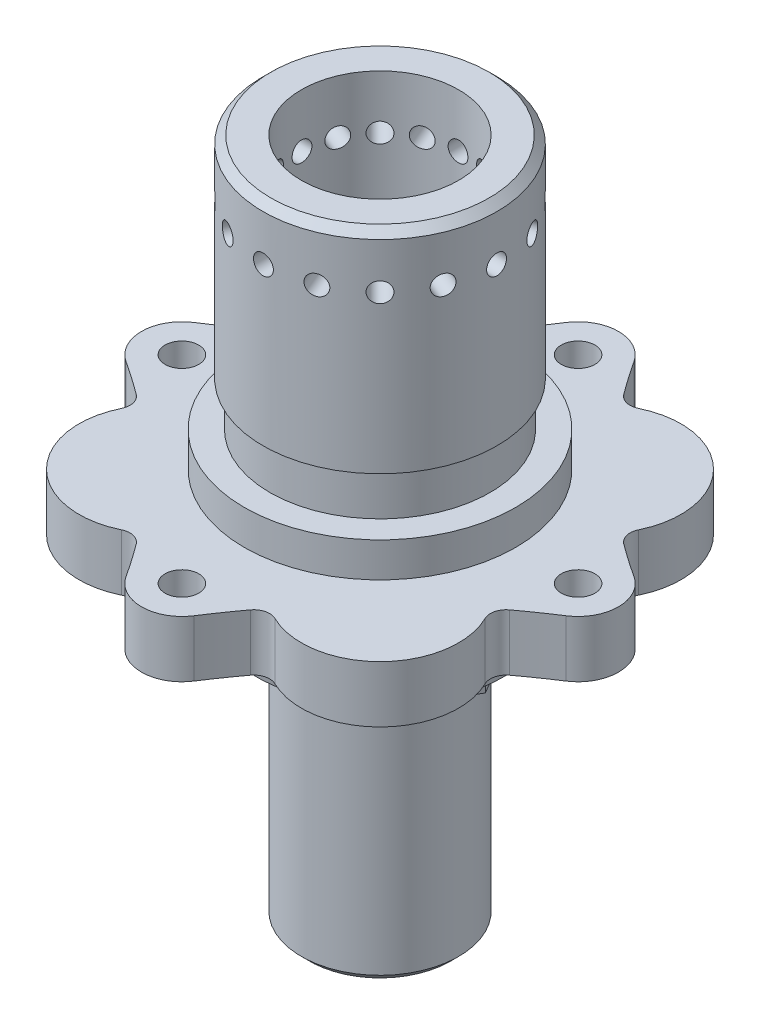
from build123d import *

# Parameters (mm, degrees)
SKETCH5_W                     = 15.875
SKETCH5_H                     = 79.375
DRIVE_PIN_HOLES_D             = 6.8
DRIVE_PIN_HOLES_PATTERN_COUNT = 4
FLANGE_SUPPORT_CUT_REACH      = 103.939
SKETCH8_R                     = 52.5
SKETCH10_R                    = 25.0825
BRAKE_HAT_HEX_DEPTH           = 4.7625
M10_CLEARANCE_HOLE1_D         = 11
SKETCH14_R                    = 2
PIN_HOLES_DEPTH               = 98.561648779
PIN_HOLE_PATTERN_COUNT        = 16
FILLET1_R                     = 3.175


with BuildPart() as part:
    # Sketch1 → Bearing Shaft/Flange Support (revolve)
    with BuildSketch(Plane(origin=(0, 0, 0), x_dir=(0, 0, -1), z_dir=(1, 0, 0))):
        Polygon((0, 0), (-27.254672075, 0), (-25.0825, -12.319), (-25.0825, -17.0815), (-15.875, -17.0815), (-15.875, -65.8749), (-14.2875, -67.4624), (0, -67.4624), align=None)
    revolve(axis=Axis((0, 0, 0), (0, 1, 0)))

    # Sketch2 → Drive Pin Support (revolve)
    with BuildSketch(Plane(origin=(0, 0, 0), x_dir=(0, 0, -1), z_dir=(1, 0, 0))):
        Polygon((0, 0), (-52.5, 0), (-52.5, 11.43), (-27.4096, 11.43), (-27.4096, 18.43), (-22.225, 18.43), (-22.225, 27.305), (-23.61946, 27.305), (-23.61946, 68.2625), (-22.03196, 69.85), (0, 69.85), align=None)
    revolve(axis=Axis((0, 0, 0), (0, 1, 0)))

    # Sketch5 → Center Mass Removal (revolve, cut)
    with BuildSketch(Plane(origin=(0, 0, 0), x_dir=(0, 0, -1), z_dir=(1, 0, 0))):
        with Locations((7.9375, 30.1625)):
            Rectangle(SKETCH5_W, SKETCH5_H)
    revolve(axis=Axis((0, 0, 0), (0, -1, 0)), mode=Mode.SUBTRACT)

    # Drive Pin Holes (through all)
    with Locations(Plane(origin=(0, 0, 0), x_dir=(-1, 0, 0), z_dir=(0, -1, 0))):
        with Locations((0, -40)):
            drive_pin_holes = Hole(DRIVE_PIN_HOLES_D / 2)

    # Drive Pin Holes Pattern: Drive Pin Holes ×4 about axis
    drive_pin_holes_pattern_axis = Axis((0, 0, 0), (0, -1, 0))
    for i in range(1, DRIVE_PIN_HOLES_PATTERN_COUNT):
        add(drive_pin_holes.rotate(drive_pin_holes_pattern_axis, i * 360 / DRIVE_PIN_HOLES_PATTERN_COUNT), mode=Mode.SUBTRACT)

    # Sketch8 → Flange Support Cut (cut, up to next)
    with BuildSketch(Plane.XZ, mode=Mode.PRIVATE) as flange_support_cut_sk1:
        Circle(SKETCH8_R)
        with BuildLine():
            ThreePointArc((-6.851776468, 44.436165629), (0, 48.1625), (6.851776468, 44.436165629))
            ThreePointArc((6.851776468, 44.436165629), (9.964767607, 39.850591878), (13.274865482, 35.405206349))
            ThreePointArc((13.274865482, 35.405206349), (33.675960454, 33.675960454), (35.405206349, 13.274865482))
            ThreePointArc((35.405206349, 13.274865482), (39.850591878, 9.964767607), (44.436165629, 6.851776468))
            ThreePointArc((44.436165629, 6.851776468), (48.1625, 0), (44.436165629, -6.851776468))
            ThreePointArc((44.436165629, -6.851776468), (39.850591878, -9.964767607), (35.405206349, -13.274865482))
            ThreePointArc((35.405206349, -13.274865482), (33.675960454, -33.675960454), (13.274865482, -35.405206349))
            ThreePointArc((13.274865482, -35.405206349), (9.964767607, -39.850591878), (6.851776468, -44.436165629))
            ThreePointArc((6.851776468, -44.436165629), (0, -48.1625), (-6.851776468, -44.436165629))
            ThreePointArc((-6.851776468, -44.436165629), (-9.964767607, -39.850591878), (-13.274865482, -35.405206349))
            ThreePointArc((-13.274865482, -35.405206349), (-33.675960454, -33.675960454), (-35.405206349, -13.274865482))
            ThreePointArc((-35.405206349, -13.274865482), (-39.850591878, -9.964767607), (-44.436165629, -6.851776468))
            ThreePointArc((-44.436165629, -6.851776468), (-48.1625, 0), (-44.436165629, 6.851776468))
            ThreePointArc((-44.436165629, 6.851776468), (-39.850591878, 9.964767607), (-35.405206349, 13.274865482))
            ThreePointArc((-35.405206349, 13.274865482), (-33.675960454, 33.675960454), (-13.274865482, 35.405206349))
            ThreePointArc((-13.274865482, 35.405206349), (-9.964767607, 39.850591878), (-6.851776468, 44.436165629))
        make_face(mode=Mode.SUBTRACT)
    flange_support_cut_tool1 = extrude(flange_support_cut_sk1.sketch, amount=-FLANGE_SUPPORT_CUT_REACH, mode=Mode.PRIVATE) & part.part
    add(flange_support_cut_tool1.solids().sort_by_distance((-51.015076, 0, 0))[0], mode=Mode.SUBTRACT)

    # Sketch10 → Brake Hat Hex (cut)
    with BuildSketch(Plane.XZ.offset(17.0815)):
        Circle(SKETCH10_R)
        Polygon((10.631905207, -18.415), (21.263810414, 0), (10.631905207, 18.415), (-10.631905207, 18.415), (-21.263810414, 0), (-10.631905207, -18.415), align=None, mode=Mode.SUBTRACT)
    extrude(amount=-BRAKE_HAT_HEX_DEPTH, mode=Mode.SUBTRACT)

    # M10 Clearance Hole1 (through all)
    with Locations(Plane(origin=(0, -67.4624, 0), x_dir=(-1, 0, 0), z_dir=(0, -1, 0))):
        with Locations((0, 0)):
            Hole(M10_CLEARANCE_HOLE1_D / 2)

    # Sketch14 → Pin Holes (cut, through all)
    with BuildSketch(Plane(origin=(0, 0, 0), x_dir=(0, 0, -1), z_dir=(1, 0, 0))):
        with Locations((0, 59.05)):
            Circle(SKETCH14_R)
    pin_holes = extrude(amount=-PIN_HOLES_DEPTH, mode=Mode.SUBTRACT)

    # Pin Hole Pattern: Pin Holes ×16 about axis
    pin_hole_pattern_axis = Axis((0, 0, 0), (0, -1, 0))
    for i in range(1, PIN_HOLE_PATTERN_COUNT):
        add(pin_holes.rotate(pin_hole_pattern_axis, i * 360 / PIN_HOLE_PATTERN_COUNT), mode=Mode.SUBTRACT)

    # Fillet1
    fillet1_edges = [part.edges().sort_by_distance(p)[0] for p in [
        (-13.274865482, 5.715, 35.405206349),
        (-35.405206349, 5.715, 13.274865482),
        (-35.405206349, 5.715, -13.274865482),
        (-13.274865482, 5.715, -35.405206349),
        (13.274865482, 5.715, -35.405206349),
        (35.405206349, 5.715, -13.274865482),
        (35.405206349, 5.715, 13.274865482),
        (13.274865482, 5.715, 35.405206349),
    ]]
    fillet(fillet1_edges, radius=FILLET1_R)


solid = part.part
